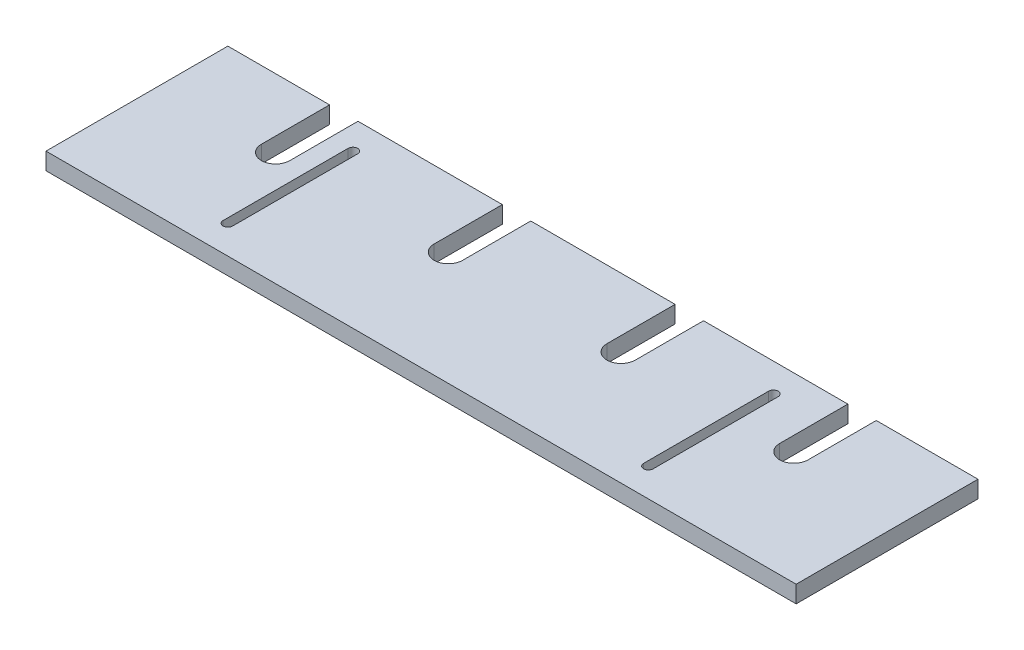
from build123d import *

# Parameters (mm, degrees)
SKETCH50_W          = 419.1
SKETCH50_H          = 101.6
BOSS_EXTRUDE4_DEPTH = 9.525
CUT_EXTRUDE7_REACH  = 217.83
CUT_EXTRUDE8_REACH  = 217.83


with BuildPart() as part:
    # Sketch50 → Boss-Extrude4 (new body)
    with BuildSketch(Plane(origin=(0, 0, 0), x_dir=(1, 0, 0), z_dir=(0, 1, 0))):
        Rectangle(SKETCH50_W, SKETCH50_H)
    extrude(amount=BOSS_EXTRUDE4_DEPTH)

    # Sketch51 → Cut-Extrude7 (cut, up to next)
    with BuildSketch(Plane.XZ, mode=Mode.PRIVATE) as cut_extrude7_sk1:
        with BuildLine():
            Line((152.7175, -12.7), (152.7175, -50.8))
            ThreePointArc((152.7175, -50.8), (144.78, -58.7375), (136.8425, -50.8))
            Line((136.8425, -50.8), (136.8425, -12.7))
            ThreePointArc((136.8425, -12.7), (144.78, -4.7625), (152.7175, -12.7))
        make_face()
    cut_extrude7_tool1 = extrude(cut_extrude7_sk1.sketch, amount=-CUT_EXTRUDE7_REACH, mode=Mode.PRIVATE) & part.part
    # Sketch51 → Cut-Extrude7 (cut, up to next)
    with BuildSketch(Plane.XZ, mode=Mode.PRIVATE) as cut_extrude7_sk2:
        with BuildLine():
            Line((40.3225, -50.8), (40.3225, -12.7))
            ThreePointArc((40.3225, -12.7), (48.26, -4.7625), (56.1975, -12.7))
            Line((56.1975, -12.7), (56.1975, -50.8))
            ThreePointArc((56.1975, -50.8), (48.26, -58.7375), (40.3225, -50.8))
        make_face()
    cut_extrude7_tool2 = extrude(cut_extrude7_sk2.sketch, amount=-CUT_EXTRUDE7_REACH, mode=Mode.PRIVATE) & part.part
    cut_extrude7_1 = cut_extrude7_tool1.solids().sort_by_distance((144.78, 0, -31.75))[0]
    add(cut_extrude7_1, mode=Mode.SUBTRACT)
    cut_extrude7_2 = cut_extrude7_tool2.solids().sort_by_distance((48.26, 0, -31.75))[0]
    add(cut_extrude7_2, mode=Mode.SUBTRACT)
    cut_extrude7 = cut_extrude7_1 + cut_extrude7_2  # Cut-Extrude7 as one shape, for the pattern or mirror that repeats it

    # Mirror4: Cut-Extrude7 across plane
    add(cut_extrude7.mirror(Plane(origin=(0, 0, 0), x_dir=(0, 0, 1), z_dir=(1, 0, 0))), mode=Mode.SUBTRACT)

    # Sketch55 → Cut-Extrude8 (cut, up to next)
    with BuildSketch(Plane.XZ, mode=Mode.PRIVATE) as cut_extrude8_sk1:
        with BuildLine():
            Line((113.792, -34.925), (113.792, 34.925))
            ThreePointArc((113.792, 34.925), (111.125, 37.592), (108.458, 34.925))
            Line((108.458, 34.925), (108.458, -34.925))
            ThreePointArc((108.458, -34.925), (111.125, -37.592), (113.792, -34.925))
        make_face()
    cut_extrude8_tool1 = extrude(cut_extrude8_sk1.sketch, amount=-CUT_EXTRUDE8_REACH, mode=Mode.PRIVATE) & part.part
    # Sketch55 → Cut-Extrude8 (cut, up to next)
    with BuildSketch(Plane.XZ, mode=Mode.PRIVATE) as cut_extrude8_sk2:
        with BuildLine():
            Line((-121.158, -34.925), (-121.158, 34.925))
            ThreePointArc((-121.158, 34.925), (-123.825, 37.592), (-126.492, 34.925))
            Line((-126.492, 34.925), (-126.492, -34.925))
            ThreePointArc((-126.492, -34.925), (-123.825, -37.592), (-121.158, -34.925))
        make_face()
    cut_extrude8_tool2 = extrude(cut_extrude8_sk2.sketch, amount=-CUT_EXTRUDE8_REACH, mode=Mode.PRIVATE) & part.part
    add(cut_extrude8_tool1.solids().sort_by_distance((111.125, 0, 0))[0], mode=Mode.SUBTRACT)
    add(cut_extrude8_tool2.solids().sort_by_distance((-123.825, 0, 0))[0], mode=Mode.SUBTRACT)


solid = part.part
